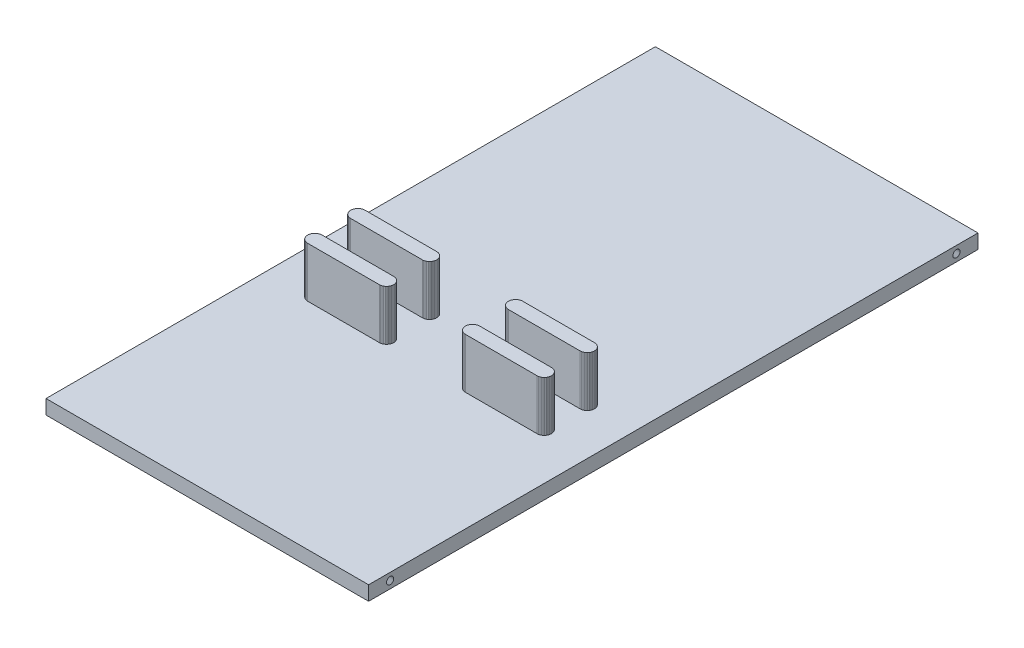
from build123d import *

# Parameters (mm, degrees)
SKETCH1_W           = 57.149998844
SKETCH1_H           = 107.950001955
BOSS_EXTRUDE1_DEPTH = 2.540000016
BOSS_EXTRUDE2_DEPTH = 8.889999939
BOSS_EXTRUDE3_DEPTH = 8.889999939
BOSS_EXTRUDE4_DEPTH = 8.889999939
BOSS_EXTRUDE5_DEPTH = 8.889999939
CUT_EXTRUDE1_DEPTH  = 10.160000063
CUT_EXTRUDE2_DEPTH  = 10.159999132
CUT_EXTRUDE3_DEPTH  = 10.159999132
CUT_EXTRUDE4_DEPTH  = 10.160000063


with BuildPart() as part:
    # Sketch1 → Boss-Extrude1 (new body)
    with BuildSketch(Plane.XZ):
        with Locations((28.574999422, 53.975000978)):
            Rectangle(SKETCH1_W, SKETCH1_H)
    extrude(amount=-BOSS_EXTRUDE1_DEPTH)

    # Sketch2 → Boss-Extrude2 (add)
    with BuildSketch(Plane(origin=(0, 2.540000016, 0), x_dir=(-1, 0, 0), z_dir=(0, 1, 0))):
        Polygon((-7.32063083, 69.440148771), (-7.19179865, 69.274626672), (-7.091967855, 69.090157747), (-7.023861632, 68.891771138), (-6.989337504, 68.684875965), (-6.989337504, 68.47512722), (-7.023861632, 68.268232048), (-7.091967855, 68.069845438), (-7.19179865, 67.885376513), (-7.32063083, 67.719854414), (-7.474950049, 67.577794194), (-7.65054673, 67.463070154), (-7.842632011, 67.378811538), (-8.045964874, 67.327320576), (-8.255000226, 67.310005426), (-20.955000073, 67.310005426), (-21.164035425, 67.327320576), (-21.36736922, 67.378811538), (-21.559452638, 67.463070154), (-21.735049784, 67.577794194), (-21.889369935, 67.719854414), (-22.018201649, 67.885376513), (-22.118031979, 68.069845438), (-22.186137736, 68.268232048), (-22.220661864, 68.47512722), (-22.220661864, 68.684875965), (-22.186137736, 68.891771138), (-22.118031979, 69.090157747), (-22.018201649, 69.274626672), (-21.889369935, 69.440148771), (-21.735049784, 69.582208991), (-21.559452638, 69.696933031), (-21.36736922, 69.781191647), (-21.164035425, 69.83268261), (-20.955000073, 69.849997759), (-8.255000226, 69.849997759), (-8.045964874, 69.83268261), (-7.842632011, 69.781191647), (-7.65054673, 69.696933031), (-7.474950049, 69.582208991), align=None)
    extrude(amount=BOSS_EXTRUDE2_DEPTH)

    # Sketch3 → Boss-Extrude3 (add)
    with BuildSketch(Plane(origin=(0, 2.540000016, 0), x_dir=(-1, 0, 0), z_dir=(0, 1, 0))):
        Polygon((-20.955000073, 59.690002352), (-21.164035425, 59.707324952), (-21.36736922, 59.758815914), (-21.559452638, 59.843070805), (-21.735049784, 59.957794845), (-21.889369935, 60.099855065), (-22.018201649, 60.265377164), (-22.118031979, 60.449849814), (-22.186137736, 60.648236424), (-22.220661864, 60.855127871), (-22.220661864, 61.064876616), (-22.186137736, 61.271768063), (-22.118031979, 61.470154673), (-22.018201649, 61.654627323), (-21.889369935, 61.820149422), (-21.735049784, 61.962209642), (-21.559452638, 62.076933682), (-21.36736922, 62.161188573), (-21.164035425, 62.212679535), (-20.955000073, 62.230002135), (-8.255000226, 62.230002135), (-8.045964874, 62.212679535), (-7.842632011, 62.161188573), (-7.65054673, 62.076933682), (-7.474950049, 61.962209642), (-7.32063083, 61.820149422), (-7.19179865, 61.654627323), (-7.091967855, 61.470154673), (-7.023861632, 61.271768063), (-6.989337504, 61.064876616), (-6.989337504, 60.855127871), (-7.023861632, 60.648236424), (-7.091967855, 60.449849814), (-7.19179865, 60.265377164), (-7.32063083, 60.099855065), (-7.474950049, 59.957794845), (-7.65054673, 59.843070805), (-7.842632011, 59.758815914), (-8.045964874, 59.707324952), (-8.255000226, 59.690002352), align=None)
    extrude(amount=BOSS_EXTRUDE3_DEPTH)

    # Sketch4 → Boss-Extrude4 (add)
    with BuildSketch(Plane(origin=(0, 2.540000016, 0), x_dir=(-1, 0, 0), z_dir=(0, 1, 0))):
        Polygon((-50.16066134, 68.684875965), (-50.126139075, 68.891771138), (-50.058033317, 69.090157747), (-49.958202988, 69.274626672), (-49.829367548, 69.440148771), (-49.675051123, 69.582208991), (-49.499452114, 69.696933031), (-49.307368696, 69.781191647), (-49.104034901, 69.83268261), (-48.895001411, 69.849997759), (-36.194998771, 69.849997759), (-35.985965282, 69.83268261), (-35.782631487, 69.781191647), (-35.590548068, 69.696933031), (-35.414949059, 69.582208991), (-35.260628909, 69.440148771), (-35.131797194, 69.274626672), (-35.031966865, 69.090157747), (-34.963861108, 68.891771138), (-34.929338843, 68.684875965), (-34.929338843, 68.47512722), (-34.963861108, 68.268232048), (-35.031966865, 68.069845438), (-35.131797194, 67.885376513), (-35.260628909, 67.719854414), (-35.414949059, 67.577794194), (-35.590548068, 67.463070154), (-35.782631487, 67.378811538), (-35.985965282, 67.327320576), (-36.194998771, 67.310005426), (-48.895001411, 67.310005426), (-49.104034901, 67.327320576), (-49.307368696, 67.378811538), (-49.499452114, 67.463070154), (-49.675051123, 67.577794194), (-49.829367548, 67.719854414), (-49.958202988, 67.885376513), (-50.058033317, 68.069845438), (-50.126139075, 68.268232048), (-50.16066134, 68.47512722), align=None)
    extrude(amount=BOSS_EXTRUDE4_DEPTH)

    # Sketch5 → Boss-Extrude5 (add)
    with BuildSketch(Plane(origin=(0, 2.540000016, 0), x_dir=(-1, 0, 0), z_dir=(0, 1, 0))):
        Polygon((-50.058033317, 61.470154673), (-49.958202988, 61.654627323), (-49.829367548, 61.820149422), (-49.675051123, 61.962209642), (-49.499452114, 62.076933682), (-49.307368696, 62.161188573), (-49.104034901, 62.212679535), (-48.895001411, 62.230002135), (-36.194998771, 62.230002135), (-35.985965282, 62.212679535), (-35.782631487, 62.161188573), (-35.590548068, 62.076933682), (-35.414949059, 61.962209642), (-35.260628909, 61.820149422), (-35.131797194, 61.654627323), (-35.031966865, 61.470154673), (-34.963861108, 61.271768063), (-34.929338843, 61.064876616), (-34.929338843, 60.855127871), (-34.963861108, 60.648236424), (-35.031966865, 60.449849814), (-35.131797194, 60.265377164), (-35.260628909, 60.099855065), (-35.414949059, 59.957794845), (-35.590548068, 59.843070805), (-35.782631487, 59.758815914), (-35.985965282, 59.707324952), (-36.194998771, 59.690002352), (-48.895001411, 59.690002352), (-49.104034901, 59.707324952), (-49.307368696, 59.758815914), (-49.499452114, 59.843070805), (-49.675051123, 59.957794845), (-49.829367548, 60.099855065), (-49.958202988, 60.265377164), (-50.058033317, 60.449849814), (-50.126139075, 60.648236424), (-50.16066134, 60.855127871), (-50.16066134, 61.064876616), (-50.126139075, 61.271768063), align=None)
    extrude(amount=BOSS_EXTRUDE5_DEPTH)

    # Sketch6 → Cut-Extrude1 (cut)
    with BuildSketch(Plane.ZY):
        Polygon((103.954054415, 1.877165865), (103.854127228, 1.837007934), (103.762410581, 1.780538121), (103.68155688, 1.709381235), (103.613898158, 1.625583973), (103.561371565, 1.531557296), (103.525489569, 1.430006116), (103.5072878, 1.323851757), (103.505007923, 1.270000008), (103.5072878, 1.216148259), (103.525489569, 1.1099939), (103.561371565, 1.008442719), (103.613898158, 0.914415927), (103.68155688, 0.830618839), (103.762410581, 0.759461836), (103.854127228, 0.702992082), (103.954054415, 0.662834151), (104.05934602, 0.640143233), (104.166954756, 0.635572185), (104.27378118, 0.649252441), (104.376763105, 0.680790457), (104.4729352, 0.729279011), (104.559533298, 0.793323095), (104.634054005, 0.871080323), (104.694366455, 0.960313715), (104.738734663, 1.058456255), (104.765869677, 1.162684523), (104.775004089, 1.270000008), (104.765869677, 1.377315493), (104.738734663, 1.481543761), (104.694366455, 1.579686301), (104.634054005, 1.668919693), (104.559533298, 1.746676979), (104.4729352, 1.810721005), (104.376763105, 1.8592095), (104.27378118, 1.890747575), (104.166954756, 1.904427889), (104.05934602, 1.899856725), align=None)
    extrude(amount=-CUT_EXTRUDE1_DEPTH, mode=Mode.SUBTRACT)

    # Sketch7 → Cut-Extrude2 (cut)
    with BuildSketch(Plane(origin=(57.149998844, 0, 0), x_dir=(0, 0, -1), z_dir=(1, 0, 0))):
        Polygon((-4.336103797, 1.625583973), (-4.38863039, 1.531557296), (-4.424512386, 1.430006116), (-4.442714155, 1.323851757), (-4.445001483, 1.270000008), (-4.442714155, 1.216148259), (-4.424512386, 1.1099939), (-4.38863039, 1.008442719), (-4.336103797, 0.914415927), (-4.268445075, 0.830618839), (-4.187591374, 0.759461836), (-4.095882643, 0.702992082), (-3.99594754, 0.662834151), (-3.890655935, 0.640143233), (-3.78305465, 0.635572185), (-3.676221007, 0.649252441), (-3.57323885, 0.680790457), (-3.477066755, 0.729279011), (-3.39047634, 0.793323095), (-3.31594795, 0.871080323), (-3.2556355, 0.960313715), (-3.21127451, 1.058456255), (-3.184132278, 1.162684523), (-3.17500555, 1.270000008), (-3.184132278, 1.377315493), (-3.21127451, 1.481543761), (-3.2556355, 1.579686301), (-3.31594795, 1.668919693), (-3.39047634, 1.746676979), (-3.477066755, 1.810721005), (-3.57323885, 1.8592095), (-3.676221007, 1.890747575), (-3.78305465, 1.904427889), (-3.890655935, 1.899856725), (-3.99594754, 1.877165865), (-4.095882643, 1.837007934), (-4.187591374, 1.780538121), (-4.268445075, 1.709381235), align=None)
    extrude(amount=-CUT_EXTRUDE2_DEPTH, mode=Mode.SUBTRACT)

    # Sketch8 → Cut-Extrude3 (cut)
    with BuildSketch(Plane(origin=(57.149998844, 0, 0), x_dir=(0, 0, -1), z_dir=(1, 0, 0))):
        Polygon((-104.425877333, 1.837007934), (-104.51759398, 1.780538121), (-104.59844023, 1.709381235), (-104.666106403, 1.625583973), (-104.718632996, 1.531557296), (-104.754507542, 1.430006116), (-104.77270931, 1.323851757), (-104.77270931, 1.216148259), (-104.754507542, 1.1099939), (-104.718632996, 1.008442719), (-104.666106403, 0.914415927), (-104.59844023, 0.830618839), (-104.51759398, 0.759461836), (-104.425877333, 0.702992082), (-104.325942695, 0.662834151), (-104.220658541, 0.640143233), (-104.113049805, 0.635572185), (-104.00621593, 0.649252441), (-103.903234005, 0.680790457), (-103.807069361, 0.729279011), (-103.720471263, 0.793323095), (-103.645950556, 0.871080323), (-103.585638106, 0.960313715), (-103.541277349, 1.058456255), (-103.514134884, 1.162684523), (-103.505007923, 1.270000008), (-103.514134884, 1.377315493), (-103.541277349, 1.481543761), (-103.585638106, 1.579686301), (-103.645950556, 1.668919693), (-103.720471263, 1.746676979), (-103.807069361, 1.810721005), (-103.903234005, 1.8592095), (-104.00621593, 1.890747575), (-104.113049805, 1.904427889), (-104.220658541, 1.899856725), (-104.325942695, 1.877165865), align=None)
    extrude(amount=-CUT_EXTRUDE3_DEPTH, mode=Mode.SUBTRACT)

    # Sketch9 → Cut-Extrude4 (cut)
    with BuildSketch(Plane.ZY):
        Polygon((4.364363849, 1.579686301), (4.304051399, 1.668919693), (4.229530692, 1.746676979), (4.142940044, 1.810721005), (4.046768416, 1.8592095), (3.943786025, 1.890747575), (3.83695215, 1.904427889), (3.729343414, 1.899856725), (3.62405926, 1.877165865), (3.524124622, 1.837007934), (3.432407742, 1.780538121), (3.351561725, 1.709381235), (3.283895552, 1.625583973), (3.231368959, 1.531557296), (3.195494413, 1.430006116), (3.177292645, 1.323851757), (3.177292645, 1.216148259), (3.195494413, 1.1099939), (3.231368959, 1.008442719), (3.283895552, 0.914415927), (3.351561725, 0.830618839), (3.432407742, 0.759461836), (3.524124622, 0.702992082), (3.62405926, 0.662834151), (3.729343414, 0.640143233), (3.83695215, 0.635572185), (3.943786025, 0.649252441), (4.046768416, 0.680790457), (4.142940044, 0.729279011), (4.229530692, 0.793323095), (4.304051399, 0.871080323), (4.364363849, 0.960313715), (4.408732057, 1.058456255), (4.435867537, 1.162684523), (4.445001483, 1.270000008), (4.435867537, 1.377315493), (4.408732057, 1.481543761), align=None)
    extrude(amount=-CUT_EXTRUDE4_DEPTH, mode=Mode.SUBTRACT)


solid = part.part
